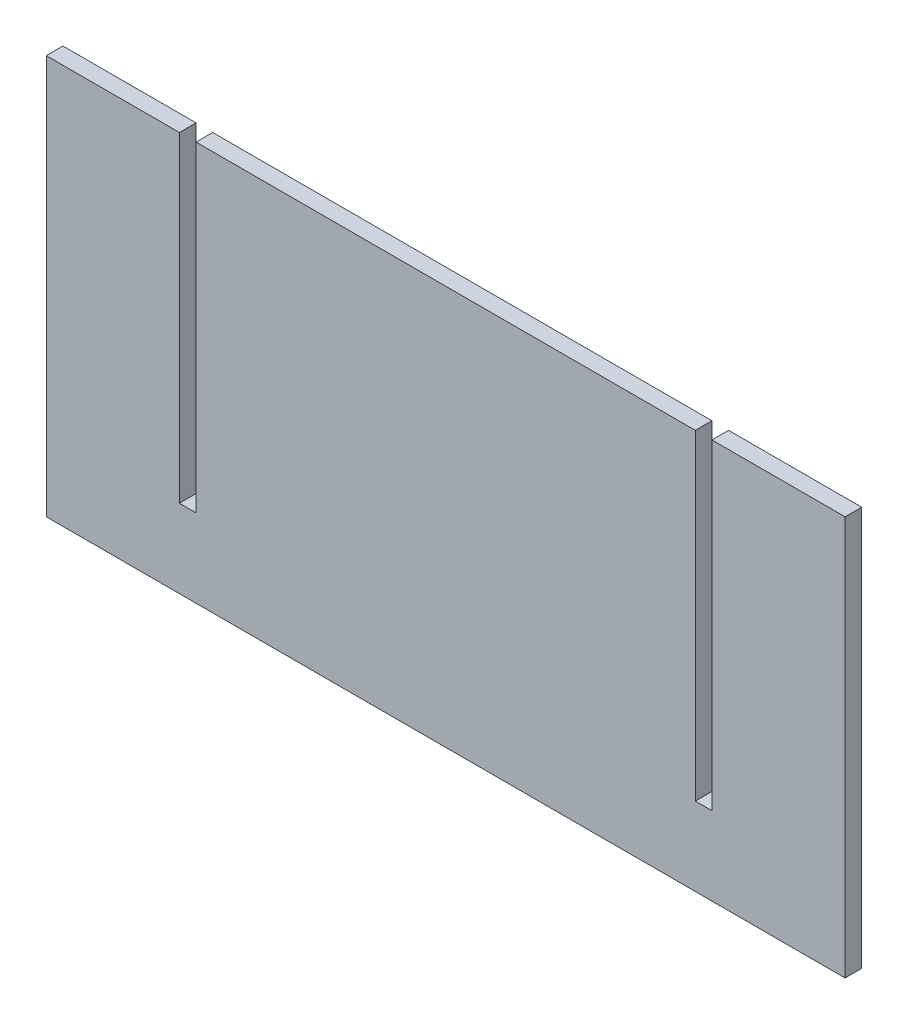
from build123d import *

# Parameters (mm, degrees)
BOSS_EXTRUDE1_DEPTH = 3.175


with BuildPart() as part:
    # Sketch1 → Boss-Extrude1 (new body)
    with BuildSketch(Plane.XY):
        Polygon((123.825, 76.2), (28.575, 76.2), (28.575, 14.942805851), (25.4, 14.942805851), (25.4, 76.2), (0, 76.2), (0, 0), (152.4, 0), (152.4, 76.2), (127, 76.2), (127, 14.942805851), (123.825, 14.942805851), align=None)
    extrude(amount=BOSS_EXTRUDE1_DEPTH)


solid = part.part
